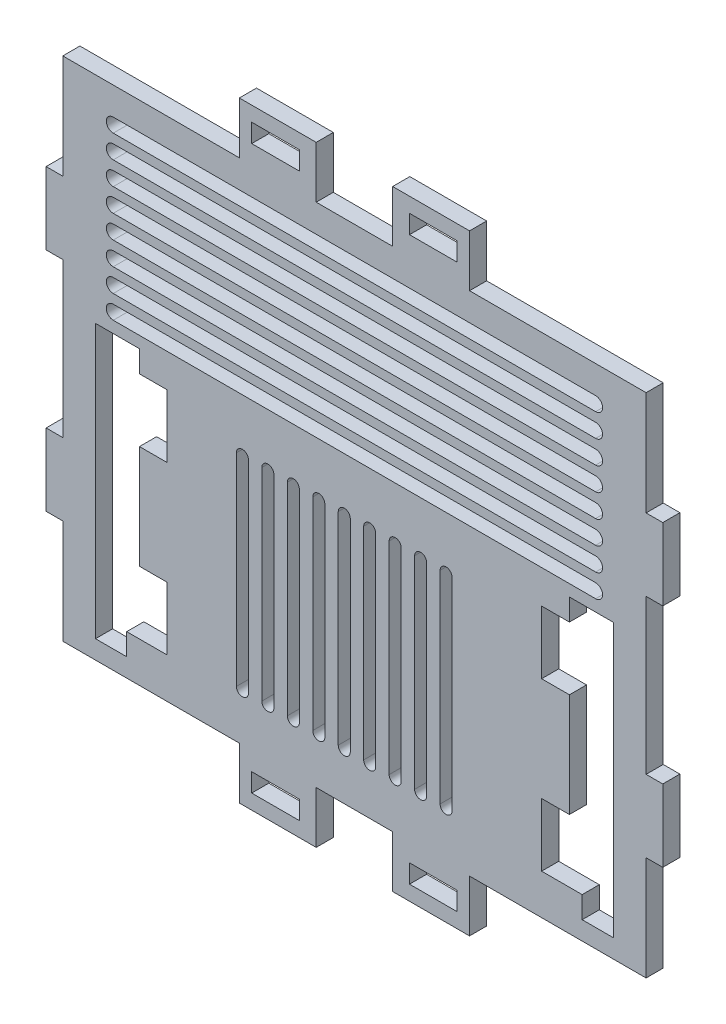
from build123d import *

# Parameters (mm, degrees)
SKETCH1_W           = 10.3
SKETCH1_H           = 4
BOSS_EXTRUDE1_DEPTH = 3.7
CUT_EXTRUDE2_DEPTH  = 94.801132722
CUT_EXTRUDE3_DEPTH  = 94.801132722
CUT_EXTRUDE4_DEPTH  = 94.801132722


with BuildPart() as part:
    # Sketch1 → Boss-Extrude1 (new body)
    with BuildSketch(Plane.XY):
        Polygon((63, -54.75), (24.86, -54.75), (24.86, -65.95), (8.26, -65.95), (8.26, -54.75), (-8.26, -54.75), (-8.26, -65.95), (-24.86, -65.95), (-24.86, -54.75), (-63, -54.75), (-63, -32.25), (-66.6, -32.25), (-66.6, -16.65), (-63, -16.65), (-63, 16.65), (-66.6, 16.65), (-66.6, 32.25), (-63, 32.25), (-63, 54.75), (-24.86, 54.75), (-24.86, 65.95), (-8.26, 65.95), (-8.26, 54.75), (8.26, 54.75), (8.26, 65.95), (24.86, 65.95), (24.86, 54.75), (63, 54.75), (63, 32.25), (66.6, 32.25), (66.6, 16.65), (63, 16.65), (63, -16.65), (66.6, -16.65), (66.6, -32.25), (63, -32.25), align=None)
        with Locations((-17.042316358, 60.75)):
            Rectangle(SKETCH1_W, SKETCH1_H, mode=Mode.SUBTRACT)
        with Locations((17.042316358, 60.75)):
            Rectangle(SKETCH1_W, SKETCH1_H, mode=Mode.SUBTRACT)
        with Locations((17.042316358, -60.75)):
            Rectangle(SKETCH1_W, SKETCH1_H, mode=Mode.SUBTRACT)
        with Locations((-17.042316358, -60.75)):
            Rectangle(SKETCH1_W, SKETCH1_H, mode=Mode.SUBTRACT)
    extrude(amount=BOSS_EXTRUDE1_DEPTH)

    # Sketch2 → Cut-Extrude2 (cut, through all)
    with BuildSketch(Plane.XY.offset(3.7)):
        with BuildLine():
            Line((52.1, 45.75), (-52.1, 45.75))
            ThreePointArc((-52.1, 45.75), (-53.6, 47.25), (-52.1, 48.75))
            Line((-52.1, 48.75), (52.1, 48.75))
            ThreePointArc((52.1, 48.75), (53.6, 47.25), (52.1, 45.75))
        make_face()
    extrude(amount=-CUT_EXTRUDE2_DEPTH, mode=Mode.SUBTRACT)

    # Sketch2<3> → Cut-Extrude3 (cut, through all)
    with BuildSketch(Plane.XY.offset(3.7)):
        with BuildLine():
            Line((52.1, 45.75), (-52.1, 45.75))
            ThreePointArc((-52.1, 45.75), (-53.6, 47.25), (-52.1, 48.75))
            Line((-52.1, 48.75), (52.1, 48.75))
            ThreePointArc((52.1, 48.75), (53.6, 47.25), (52.1, 45.75))
        make_face()
        with BuildLine():
            Line((52.1, 40.75), (-52.1, 40.75))
            ThreePointArc((-52.1, 40.75), (-53.6, 42.25), (-52.1, 43.75))
            Line((-52.1, 43.75), (52.1, 43.75))
            ThreePointArc((52.1, 43.75), (53.6, 42.25), (52.1, 40.75))
        make_face()
        with BuildLine():
            Line((52.1, 35.75), (-52.1, 35.75))
            ThreePointArc((-52.1, 35.75), (-53.6, 37.25), (-52.1, 38.75))
            Line((-52.1, 38.75), (52.1, 38.75))
            ThreePointArc((52.1, 38.75), (53.6, 37.25), (52.1, 35.75))
        make_face()
        with BuildLine():
            Line((52.1, 30.75), (-52.1, 30.75))
            ThreePointArc((-52.1, 30.75), (-53.6, 32.25), (-52.1, 33.75))
            Line((-52.1, 33.75), (52.1, 33.75))
            ThreePointArc((52.1, 33.75), (53.6, 32.25), (52.1, 30.75))
        make_face()
        with BuildLine():
            Line((52.1, 25.75), (-52.1, 25.75))
            ThreePointArc((-52.1, 25.75), (-53.6, 27.25), (-52.1, 28.75))
            Line((-52.1, 28.75), (52.1, 28.75))
            ThreePointArc((52.1, 28.75), (53.6, 27.25), (52.1, 25.75))
        make_face()
        with BuildLine():
            Line((52.1, 20.75), (-52.1, 20.75))
            ThreePointArc((-52.1, 20.75), (-53.6, 22.25), (-52.1, 23.75))
            Line((-52.1, 23.75), (52.1, 23.75))
            ThreePointArc((52.1, 23.75), (53.6, 22.25), (52.1, 20.75))
        make_face()
        with BuildLine():
            Line((52.1, 15.75), (-52.1, 15.75))
            ThreePointArc((-52.1, 15.75), (-53.6, 17.25), (-52.1, 18.75))
            Line((-52.1, 18.75), (52.1, 18.75))
            ThreePointArc((52.1, 18.75), (53.6, 17.25), (52.1, 15.75))
        make_face()
        with BuildLine():
            Line((52.1, 10.75), (-52.1, 10.75))
            ThreePointArc((-52.1, 10.75), (-53.6, 12.25), (-52.1, 13.75))
            Line((-52.1, 13.75), (52.1, 13.75))
            ThreePointArc((52.1, 13.75), (53.6, 12.25), (52.1, 10.75))
        make_face()
        with BuildLine():
            Line((-25.5, -44.45), (-25.5, -0.75))
            ThreePointArc((-25.5, -0.75), (-24.2, 0.55), (-22.9, -0.75))
            Line((-22.9, -0.75), (-22.9, -44.45))
            ThreePointArc((-22.9, -44.45), (-24.2, -45.75), (-25.5, -44.45))
        make_face()
        with BuildLine():
            Line((-20, -44.45), (-20, -0.75))
            ThreePointArc((-20, -0.75), (-18.7, 0.55), (-17.4, -0.75))
            Line((-17.4, -0.75), (-17.4, -44.45))
            ThreePointArc((-17.4, -44.45), (-18.7, -45.75), (-20, -44.45))
        make_face()
        with BuildLine():
            Line((-14.5, -44.45), (-14.5, -0.75))
            ThreePointArc((-14.5, -0.75), (-13.2, 0.55), (-11.9, -0.75))
            Line((-11.9, -0.75), (-11.9, -44.45))
            ThreePointArc((-11.9, -44.45), (-13.2, -45.75), (-14.5, -44.45))
        make_face()
        with BuildLine():
            Line((-9, -44.45), (-9, -0.75))
            ThreePointArc((-9, -0.75), (-7.7, 0.55), (-6.4, -0.75))
            Line((-6.4, -0.75), (-6.4, -44.45))
            ThreePointArc((-6.4, -44.45), (-7.7, -45.75), (-9, -44.45))
        make_face()
        with BuildLine():
            Line((-3.5, -44.45), (-3.5, -0.75))
            ThreePointArc((-3.5, -0.75), (-2.2, 0.55), (-0.9, -0.75))
            Line((-0.9, -0.75), (-0.9, -44.45))
            ThreePointArc((-0.9, -44.45), (-2.2, -45.75), (-3.5, -44.45))
        make_face()
        with BuildLine():
            Line((2, -44.45), (2, -0.75))
            ThreePointArc((2, -0.75), (3.3, 0.55), (4.6, -0.75))
            Line((4.6, -0.75), (4.6, -44.45))
            ThreePointArc((4.6, -44.45), (3.3, -45.75), (2, -44.45))
        make_face()
        with BuildLine():
            Line((7.5, -44.45), (7.5, -0.75))
            ThreePointArc((7.5, -0.75), (8.8, 0.55), (10.1, -0.75))
            Line((10.1, -0.75), (10.1, -44.45))
            ThreePointArc((10.1, -44.45), (8.8, -45.75), (7.5, -44.45))
        make_face()
        with BuildLine():
            Line((13, -44.45), (13, -0.75))
            ThreePointArc((13, -0.75), (14.3, 0.55), (15.6, -0.75))
            Line((15.6, -0.75), (15.6, -44.45))
            ThreePointArc((15.6, -44.45), (14.3, -45.75), (13, -44.45))
        make_face()
        with BuildLine():
            Line((18.5, -44.45), (18.5, -0.75))
            ThreePointArc((18.5, -0.75), (19.8, 0.55), (21.1, -0.75))
            Line((21.1, -0.75), (21.1, -44.45))
            ThreePointArc((21.1, -44.45), (19.8, -45.75), (18.5, -44.45))
        make_face()
    extrude(amount=-CUT_EXTRUDE3_DEPTH, mode=Mode.SUBTRACT)

    # Sketch4 → Cut-Extrude4 (cut, through all)
    with BuildSketch(Plane.XY.offset(3.7)):
        Polygon((-55.935998942, 8.25), (-55.935998942, -50.75), (-49.192042483, -50.75), (-49.192042483, -46.05), (-40.435998942, -46.05), (-40.435998942, -32.45), (-46.435998942, -32.45), (-46.435998942, -10.05), (-40.435998942, -10.05), (-40.435998942, 3.55), (-46.435998942, 3.55), (-46.435998942, 8.25), align=None)
        Polygon((46.435998942, 3.55), (46.435998942, 8.25), (55.935998942, 8.25), (55.935998942, -50.75), (49.192042483, -50.75), (49.192042483, -46.05), (40.435998942, -46.05), (40.435998942, -32.45), (46.435998942, -32.45), (46.435998942, -10.05), (40.435998942, -10.05), (40.435998942, 3.55), align=None)
    extrude(amount=-CUT_EXTRUDE4_DEPTH, mode=Mode.SUBTRACT)


solid = part.part
